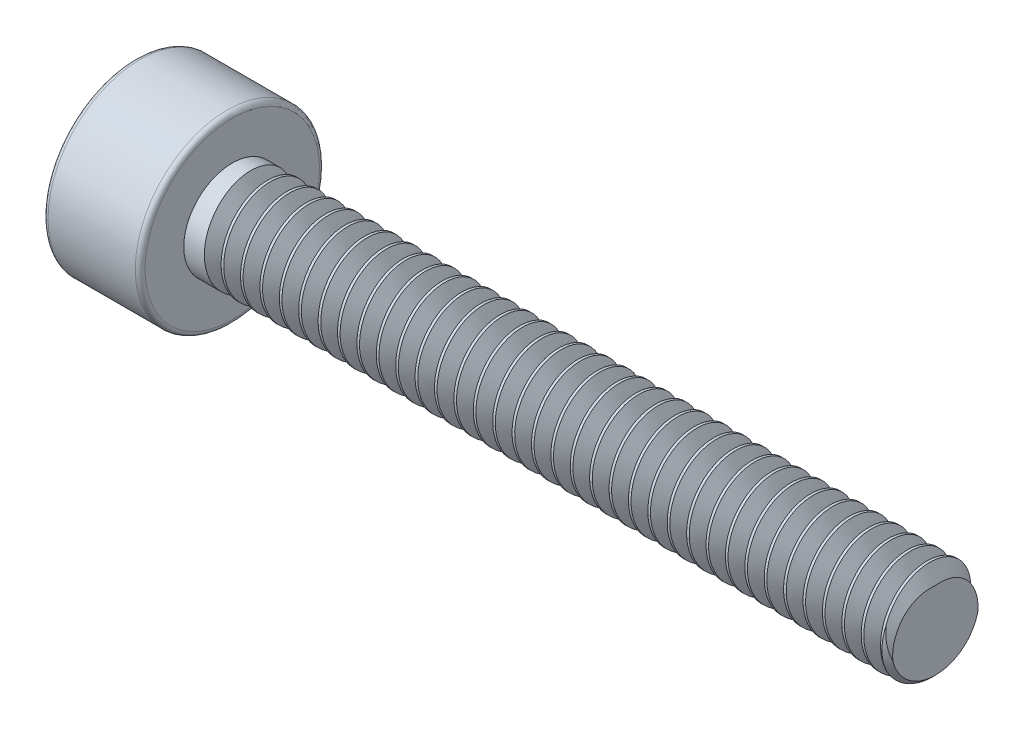
from build123d import *

# Parameters (mm, degrees)
EXTRUDE1_DEPTH   = 1
CUT_SWEEP2_PITCH = 0.4


with BuildPart() as part:
    # Sketch1 → Revolve1 (revolve)
    with BuildSketch(Plane.XY, mode=Mode.PRIVATE) as revolve1_sk:
        with BuildLine():
            Line((0, 0), (0, 1.8))
            ThreePointArc((0, 1.8), (-0.029289322, 1.870710678), (-0.1, 1.9))
            Line((-0.1, 1.9), (-1.9, 1.9))
            ThreePointArc((-1.9, 1.9), (-1.970710678, 1.870710678), (-2, 1.8))
            Line((-2, 1.8), (-2, 0))
            Line((-2, 0), (0, 0))
        make_face()
    revolve(revolve1_sk.sketch.rotate(Axis((0, 0, 0), (-1, 0, 0)), 90), axis=Axis((0, 0, 0), (-1, 0, 0)))

    # Sketch2 → Extrude1 (cut)
    with BuildSketch(Plane.ZY.offset(2)):
        Polygon((0.866025404, 0), (0.433012702, 0.75), (-0.433012702, 0.75), (-0.866025404, 0), (-0.433012702, -0.75), (0.433012702, -0.75), align=None)
    extrude(amount=-EXTRUDE1_DEPTH, mode=Mode.SUBTRACT)

    # Sketch3 → Revolve2 (revolve)
    with BuildSketch(Plane.XY, mode=Mode.PRIVATE) as revolve2_sk:
        Polygon((14.5, 0.9), (14.4, 1), (0, 1), (0, 0), (14.5, 0), align=None)
    revolve(revolve2_sk.sketch.rotate(Axis((0, 0, 0), (1, 0, 0)), 90), axis=Axis((0, 0, 0), (1, 0, 0)))

    # Cut-Sweep2: the profile of Sketch4 screwed along a right-hand helix of 36.5 turns, 6 arcs to a turn; built about Z, then put on its axis
    cut_sweep2_z = Axis((0, 0, 0), (0, 0, 1))
    cut_sweep2_corners = [(1.1, 0, -0.169059892), (0.7, 0, -0.4), (1.1, 0, -0.630940108)]
    with BuildLine(mode=Mode.PRIVATE) as cut_sweep2_profile:
        Line(cut_sweep2_corners[0], cut_sweep2_corners[1])
        Line(cut_sweep2_corners[1], cut_sweep2_corners[2])
        Line(cut_sweep2_corners[2], cut_sweep2_corners[0])
    cut_sweep2_cap = Face(cut_sweep2_profile.wire())
    cut_sweep2_turn_angles = [0, 30, 60, 90, 120, 150, 180, 210, 240, 270, 300, 330, 360]
    cut_sweep2_turn_weights = [1, 0.8660254037844387, 1, 0.8660254037844387, 1, 0.8660254037844387, 1, 0.8660254037844387, 1, 0.8660254037844387, 1, 0.8660254037844387, 1]
    cut_sweep2_turn_rails = [Edge.make_bspline([Vector(p[0], p[1], 0).rotate(cut_sweep2_z, cut_sweep2_turn_angles[k]) / cut_sweep2_turn_weights[k] + Vector(0, 0, p[2] + CUT_SWEEP2_PITCH * cut_sweep2_turn_angles[k] / 360) for k in range(13)], [0, 0, 0, 1, 1, 2, 2, 3, 3, 4, 4, 5, 5, 6, 6, 6], 2, cut_sweep2_turn_weights) for p in cut_sweep2_corners]
    cut_sweep2_turn_sides = [Face.make_surface_from_curves(cut_sweep2_turn_rails[p[0]], cut_sweep2_turn_rails[p[1]]) for p in [(0, 1), (1, 2), (2, 0)]]
    cut_sweep2_last_angles = [12960, 12990, 13020, 13050, 13080, 13110, 13140]
    cut_sweep2_last_weights = [1, 0.8660254037844387, 1, 0.8660254037844387, 1, 0.8660254037846689, 1]
    cut_sweep2_last_rails = [Edge.make_bspline([Vector(p[0], p[1], 0).rotate(cut_sweep2_z, cut_sweep2_last_angles[k]) / cut_sweep2_last_weights[k] + Vector(0, 0, p[2] + CUT_SWEEP2_PITCH * cut_sweep2_last_angles[k] / 360) for k in range(7)], [0, 0, 0, 1, 1, 2, 2, 3, 3, 3], 2, cut_sweep2_last_weights) for p in cut_sweep2_corners]
    cut_sweep2_last_sides = [Face.make_surface_from_curves(cut_sweep2_last_rails[p[0]], cut_sweep2_last_rails[p[1]]) for p in [(0, 1), (1, 2), (2, 0)]]
    cut_sweep2 = Plane(origin=(14.5, 0, 0), x_dir=(0, 1, 0), z_dir=(-1, 0, 0)) * Solid(Shell([*[p.moved(Location((0, 0, CUT_SWEEP2_PITCH * i))) for i in range(36) for p in cut_sweep2_turn_sides], *cut_sweep2_last_sides, cut_sweep2_cap, cut_sweep2_cap.rotate(cut_sweep2_z, 13140).moved(Location((0, 0, CUT_SWEEP2_PITCH * 13140 / 360)))]))
    add(cut_sweep2, mode=Mode.SUBTRACT)


solid = part.part
